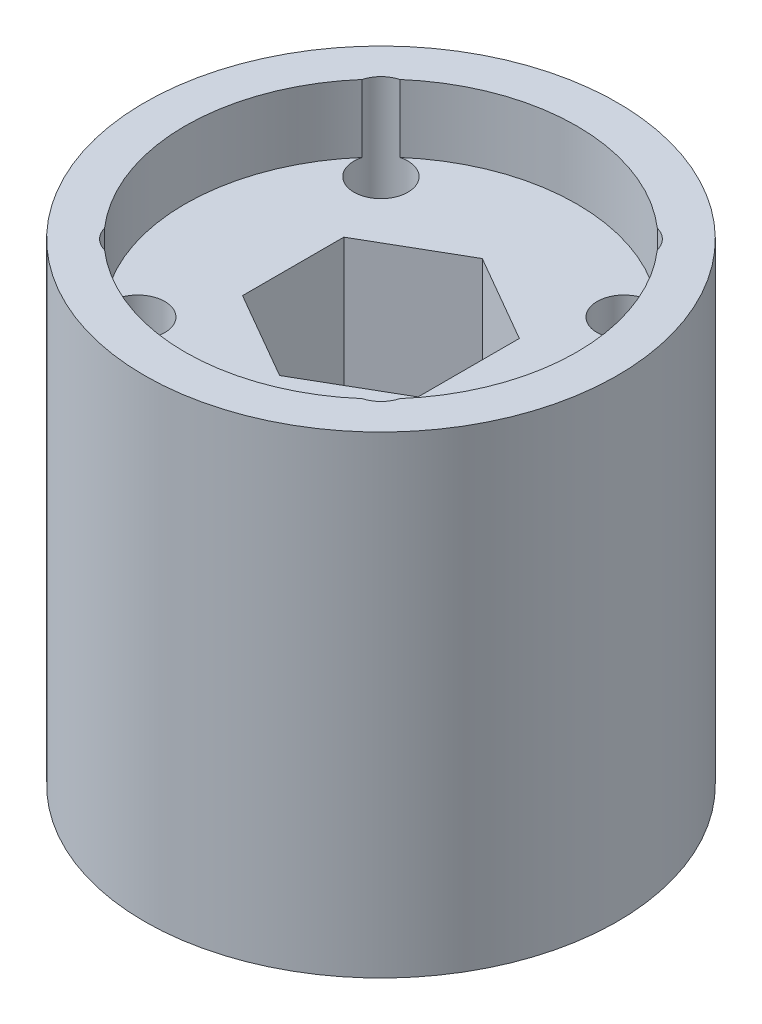
from build123d import *

# Parameters (mm, degrees)
SKETCH1_R           = 17.5
BOSS_EXTRUDE1_DEPTH = 35
CUT_EXTRUDE1_DEPTH  = 15
SKETCH3_R           = 4.1
CUT_EXTRUDE2_DEPTH  = 32.819805153
SKETCH4_R           = 2
CUT_EXTRUDE3_DEPTH  = 43.866070499
SKETCH5_R           = 14.5
CUT_EXTRUDE4_DEPTH  = 5


with BuildPart() as part:
    # Sketch1 → Boss-Extrude1 (new body)
    with BuildSketch(Plane(origin=(0, 0, 0), x_dir=(1, 0, 0), z_dir=(0, 1, 0))):
        Circle(SKETCH1_R)
    extrude(amount=BOSS_EXTRUDE1_DEPTH)

    # Sketch2 → Cut-Extrude1 (cut)
    with BuildSketch(Plane(origin=(0, 35, 0), x_dir=(1, 0, 0), z_dir=(0, 1, 0))):
        Polygon((0, 7.5), (-6.495190528, 3.75), (-6.495190528, -3.75), (0, -7.5), (6.495190528, -3.75), (6.495190528, 3.75), align=None)
    extrude(amount=-CUT_EXTRUDE1_DEPTH, mode=Mode.SUBTRACT)

    # Sketch3 → Cut-Extrude2 (cut, through all)
    with BuildSketch(Plane(origin=(0, 20, 0), x_dir=(1, 0, 0), z_dir=(0, 1, 0))):
        Circle(SKETCH3_R)
    extrude(amount=-CUT_EXTRUDE2_DEPTH, mode=Mode.SUBTRACT)

    # Sketch4 → Cut-Extrude3 (cut, through all)
    with BuildSketch(Plane(origin=(0, 35, 0), x_dir=(1, 0, 0), z_dir=(0, 1, 0))):
        with Locations((-9, 9)):
            Circle(SKETCH4_R)
        with Locations((9, 9)):
            Circle(SKETCH4_R)
        with Locations((9, -9)):
            Circle(SKETCH4_R)
        with Locations((-9, -9)):
            Circle(SKETCH4_R)
    extrude(amount=-CUT_EXTRUDE3_DEPTH, mode=Mode.SUBTRACT)

    # Sketch5 → Cut-Extrude4 (cut)
    with BuildSketch(Plane(origin=(0, 35, 0), x_dir=(1, 0, 0), z_dir=(0, 1, 0))):
        Circle(SKETCH5_R)
    extrude(amount=-CUT_EXTRUDE4_DEPTH, mode=Mode.SUBTRACT)


solid = part.part
